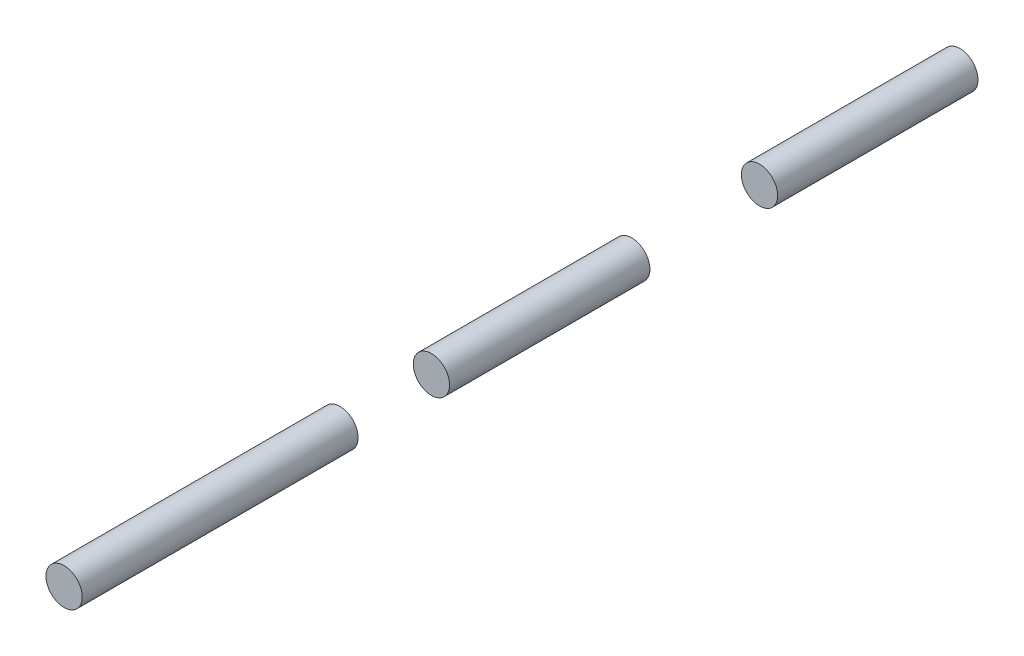
from build123d import *

# Parameters (mm, degrees)
BOSS_EXTRUDE1_OUTLINE_R = 6.35
BOSS_EXTRUDE1_DEPTH     = 70.104
SKETCH3_R               = 6.35
BOSS_EXTRUDE2_DEPTH     = 70.104
SKETCH4_R               = 6.35
BOSS_EXTRUDE3_DEPTH     = 96.52


# Read off the part's stored shape, not the designer's step: Boss-Extrude1
with BuildPart() as part:
    # Boss-Extrude1 outline → Boss-Extrude1 (new body)
    with BuildSketch(Plane.XY.offset(-22.86)):
        Circle(BOSS_EXTRUDE1_OUTLINE_R)
    extrude(amount=BOSS_EXTRUDE1_DEPTH)


with BuildPart() as body_2:
    # Sketch3 → Boss-Extrude2 (new body)
    with BuildSketch(Plane.XY.offset(91.948)):
        Circle(SKETCH3_R)
    extrude(amount=BOSS_EXTRUDE2_DEPTH)


with BuildPart() as body_3:
    # Sketch4 → Boss-Extrude3 (new body)
    with BuildSketch(Plane.XY.offset(194.056)):
        Circle(SKETCH4_R)
    extrude(amount=BOSS_EXTRUDE3_DEPTH)


solid = Compound([part.part, body_2.part, body_3.part])
